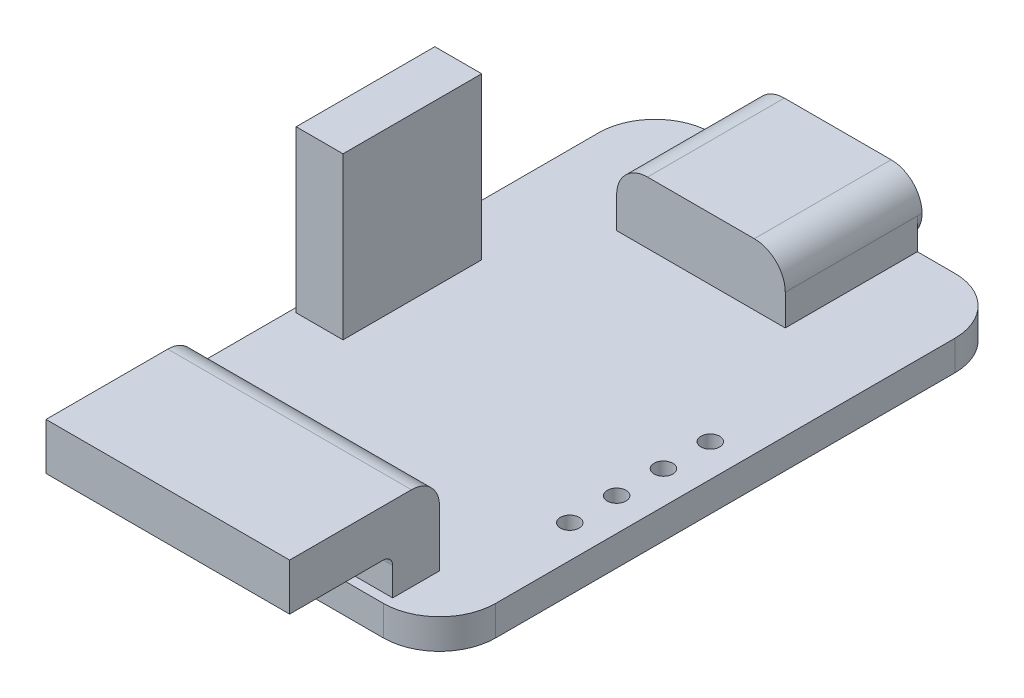
from build123d import *
from OCP.BRepFilletAPI import BRepFilletAPI_MakeFillet

# Parameters (mm, degrees)
SKETCH1_W           = 19
SKETCH1_H           = 30.5
SKETCH1_R           = 0.5
PCB_DEPTH           = 1.6
PCB_FILLET_R        = 3
USB_START           = 1.6
SKETCH1_3_W         = 9
SKETCH1_3_H         = 7.05
SKETCH1_3_H_2       = 0.25
USB_C_DEPTH         = 3.3
USB_C_FILLET_R      = 1.65
POWER_START         = 1.6
SKETCH1_4_W         = 2.5
SKETCH1_4_H         = 7.4
POWER_JUMPERS_DEPTH = 8.6
UART_START          = 1.6
SKETCH1_5_W         = 13
SKETCH1_5_H         = 2.5
UART_TO_BOARD_DEPTH = 4.5
SKETCH3_W           = 13
SKETCH3_H           = 2.5
UART_PINS_DEPTH     = 5.5
UART_FILLET_R1      = 1.5
UART_FILLET_R2      = 0.5
LPATTERN1_OUTLINE_R = 0.5
LPATTERN1_DEPTH     = 1.6


# Read off the part's stored shape, not the designer's step: LPattern1
with BuildPart() as part:
    # Sketch1 → PCB (new body)
    with BuildSketch(Plane(origin=(0, 0, 0), x_dir=(1, 0, 0), z_dir=(0, 1, 0))):
        Rectangle(SKETCH1_W, SKETCH1_H)
        with Locations(Location((7.75, 0.95, 0), (0, 0, 270))):
            Circle(SKETCH1_R, mode=Mode.SUBTRACT)
    extrude(amount=PCB_DEPTH)

    # PCB Fillet
    pcb_fillet_edges = [part.edges().sort_by_distance(p)[0] for p in [
        (9.5, 0.8, -15.25),
        (9.5, 0.8, 15.25),
        (-9.5, 0.8, 15.25),
        (-9.5, 0.8, -15.25),
    ]]
    fillet(pcb_fillet_edges, radius=PCB_FILLET_R)

    # Sketch1<3> → USB C (add)
    with BuildSketch(Plane(origin=(0, 0, 0), x_dir=(1, 0, 0), z_dir=(0, 1, 0)).offset(USB_START)):
        with Locations((0, 11.725)):
            Rectangle(SKETCH1_3_W, SKETCH1_3_H)
        with Locations((0, 15.375)):
            Rectangle(SKETCH1_3_W, SKETCH1_3_H_2)
    extrude(amount=USB_C_DEPTH)

    # USB C Fillet
    usb_c_fillet_edges = [part.edges().sort_by_distance(p)[0] for p in [
        (-4.5, 4.9, -11.85),
        (-4.5, 1.6, -15.375),
        (4.5, 4.9, -11.85),
        (4.5, 1.6, -15.375),
    ]]
    fillet(usb_c_fillet_edges, radius=USB_C_FILLET_R - 0.0001)  # a hair under: the kernel refuses the full size

    # Sketch1<4> → Power Jumpers (add)
    with BuildSketch(Plane(origin=(0, 0, 0), x_dir=(1, 0, 0), z_dir=(0, 1, 0)).offset(POWER_START)):
        with Locations((-8, -0.45)):
            Rectangle(SKETCH1_4_W, SKETCH1_4_H)
    extrude(amount=POWER_JUMPERS_DEPTH)

    # Sketch1<5> → UART To Board (add)
    with BuildSketch(Plane(origin=(0, 0, 0), x_dir=(1, 0, 0), z_dir=(0, 1, 0)).offset(UART_START)):
        with Locations((0, -13.5)):
            Rectangle(SKETCH1_5_W, SKETCH1_5_H)
    extrude(amount=UART_TO_BOARD_DEPTH)

    # Sketch3 → UART Pins (add)
    with BuildSketch(Plane.XY.offset(14.75)):
        with Locations((0, 4.85)):
            Rectangle(SKETCH3_W, SKETCH3_H)
    extrude(amount=UART_PINS_DEPTH)

    # UART Fillet: one fillet with a radius per group of edges: ONE call of the kernel's fillet builder (fillet() takes one radius for all edges)
    uart_fillet_edges_1 = [part.edges().sort_by_distance(p)[0] for p in [
        (0, 6.1, 12.25),
    ]]
    uart_fillet_edges_2 = [part.edges().sort_by_distance(p)[0] for p in [
        (0, 3.6, 14.75),
    ]]
    uart_fillet = BRepFilletAPI_MakeFillet(part.part.solid().wrapped)
    for e in uart_fillet_edges_1:
        uart_fillet.Add(UART_FILLET_R1, e.wrapped)
    for e in uart_fillet_edges_2:
        uart_fillet.Add(UART_FILLET_R2, e.wrapped)
    add(Compound.cast(uart_fillet.Shape()), mode=Mode.REPLACE)

    # LPattern1 outline → LPattern1 (cut)
    with BuildSketch(Plane(origin=(0, 0, 0), x_dir=(1, 0, 0), z_dir=(0, 1, 0))):
        with Locations((7.75, -6.55)):
            Circle(LPATTERN1_OUTLINE_R)
        with Locations((7.75, -4.05)):
            Circle(LPATTERN1_OUTLINE_R)
        with Locations((7.75, -1.55)):
            Circle(LPATTERN1_OUTLINE_R)
    extrude(amount=LPATTERN1_DEPTH, mode=Mode.SUBTRACT)


solid = part.part
